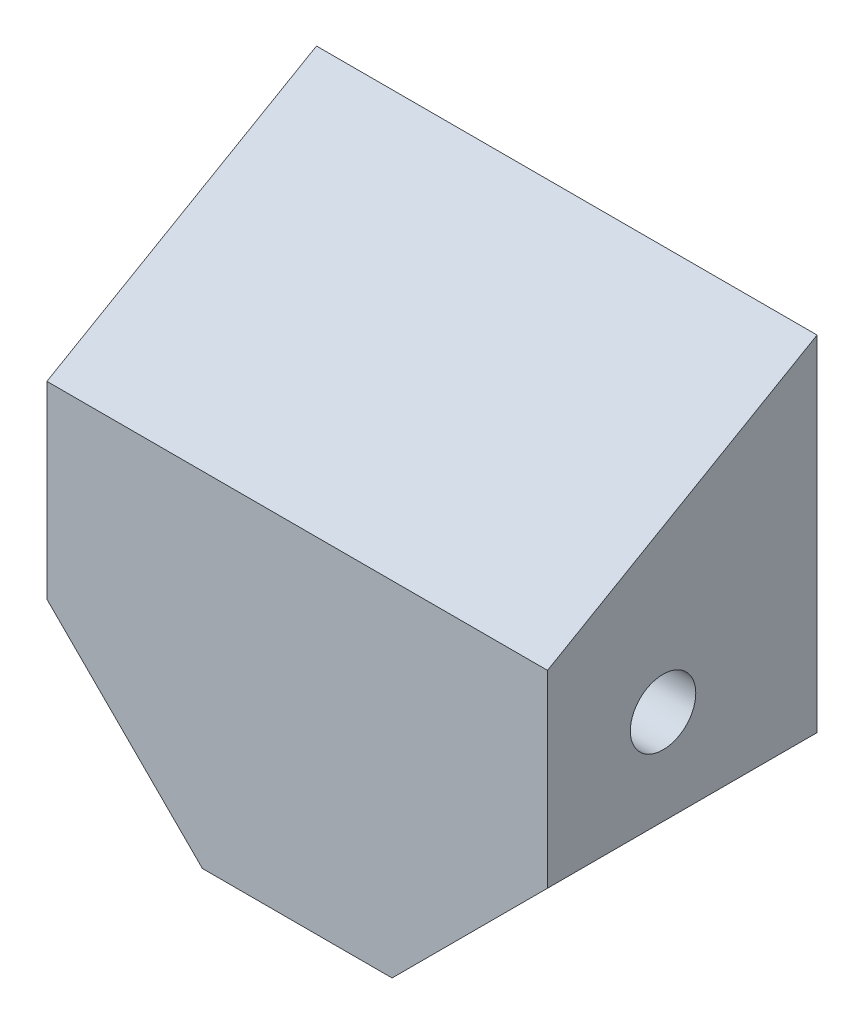
from build123d import *

# Parameters (mm, degrees)
SKETCH2_W               = 330.2
SKETCH2_H               = 330.2
BOSS_EXTRUDE1_DEPTH     = 177.8
CUT_EXTRUDE1_DEPTH      = 410.759551445
CUT_EXTRUDE1_DEPTH_BACK = 410.759551445
SKETCH3_R               = 21.59
SKETCH5_R               = 8.382
CUT_EXTRUDE3_DEPTH      = 101.6
SKETCH6_R               = 21.59
CUT_EXTRUDE4_DEPTH      = 165.1
CHAMFER6_SIZE           = 103.195588962
CHAMFER6_SIZE_2         = 178.7400032
CHAMFER7_SIZE           = 102.5400032


with BuildPart() as part:
    # Sketch2 → Boss-Extrude1 (new body)
    with BuildSketch(Plane.XY):
        Rectangle(SKETCH2_W, SKETCH2_H)
    extrude(amount=BOSS_EXTRUDE1_DEPTH)

    # Sketch3 → Cut-Extrude1 (cut, two sides: drawn at the far end of the back side and taken through both)
    with BuildSketch(Plane(origin=(165.1, 0, 0), x_dir=(0, 0, -1), z_dir=(1, 0, 0)).offset(-CUT_EXTRUDE1_DEPTH_BACK)):
        with Locations((-101.6, 0)):
            Circle(SKETCH3_R)
    extrude(amount=CUT_EXTRUDE1_DEPTH + CUT_EXTRUDE1_DEPTH_BACK, mode=Mode.SUBTRACT)

    # Sketch5 → Cut-Extrude3 (cut)
    with BuildSketch(Plane(origin=(0, 0, 0), x_dir=(-1, 0, 0), z_dir=(0, 0, -1))):
        Circle(SKETCH5_R)
    extrude(amount=-CUT_EXTRUDE3_DEPTH, mode=Mode.SUBTRACT)

    # Sketch6 → Cut-Extrude4 (cut)
    with BuildSketch(Plane.XZ.offset(165.1)):
        with Locations(Location((0, 101.6, 0), (0, 0, 270))):
            Circle(SKETCH6_R)
    extrude(amount=-CUT_EXTRUDE4_DEPTH, mode=Mode.SUBTRACT)

    # Chamfer6
    # the kernel refuses this chamfer: 178.7400032, 103.195588962 mm, written as the material it takes off along each edge
    with BuildSketch(Plane(origin=(627.515716064, 165.1, 177.8), x_dir=(0, -1, 0), z_dir=(-1, 0, 0))) as chamfer6_piece_1:
        Polygon((CHAMFER6_SIZE, 0), (0, -CHAMFER6_SIZE_2), (0, 0), align=None)
    extrude(amount=1255.031432128, mode=Mode.SUBTRACT)

    # Chamfer7
    chamfer7_edges = [part.edges().sort_by_distance(p)[0] for p in [
        (165.1, -165.1, 88.9),
        (-165.1, -165.1, 88.9),
    ]]
    chamfer(chamfer7_edges, length=CHAMFER7_SIZE)


solid = part.part
